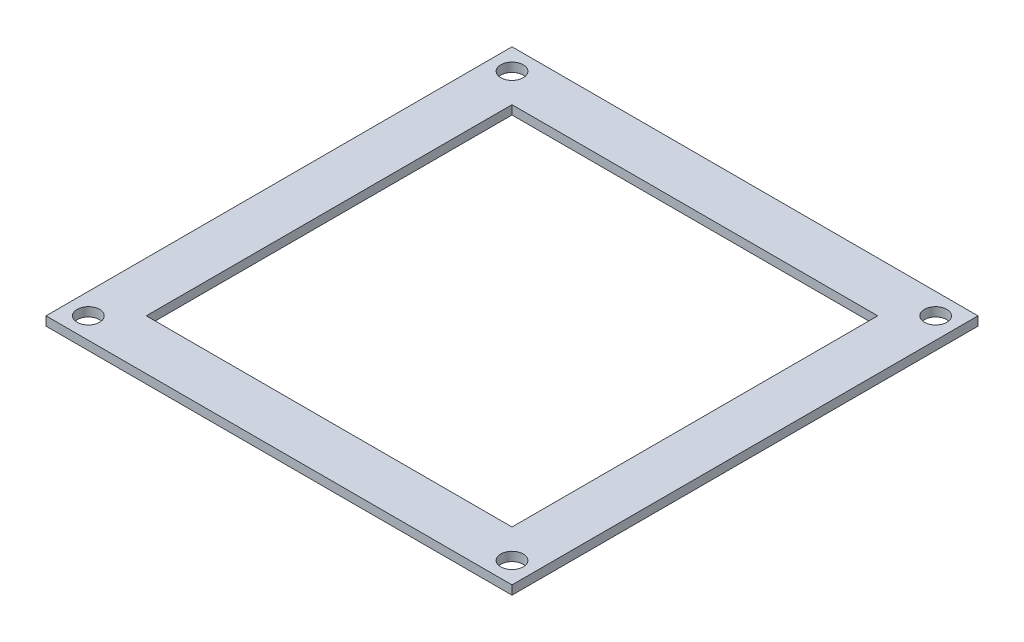
from build123d import *

# Parameters (mm, degrees)
SKETCH1_W           = 66
SKETCH1_H           = 66
SKETCH1_R           = 1.59
SKETCH1_W_2         = 51.8
SKETCH1_H_2         = 51.8
BOSS_EXTRUDE1_DEPTH = 1.27


with BuildPart() as part:
    # Sketch1 → Boss-Extrude1 (new body)
    with BuildSketch(Plane(origin=(0, 0, 0), x_dir=(1, 0, 0), z_dir=(0, 1, 0))):
        Rectangle(SKETCH1_W, SKETCH1_H)
        with Locations((-30, 30)):
            Circle(SKETCH1_R, mode=Mode.SUBTRACT)
        with Locations((30, 30)):
            Circle(SKETCH1_R, mode=Mode.SUBTRACT)
        with Locations((30, -30)):
            Circle(SKETCH1_R, mode=Mode.SUBTRACT)
        with Locations((-30, -30)):
            Circle(SKETCH1_R, mode=Mode.SUBTRACT)
        Rectangle(SKETCH1_W_2, SKETCH1_H_2, mode=Mode.SUBTRACT)
    extrude(amount=BOSS_EXTRUDE1_DEPTH)


solid = part.part
